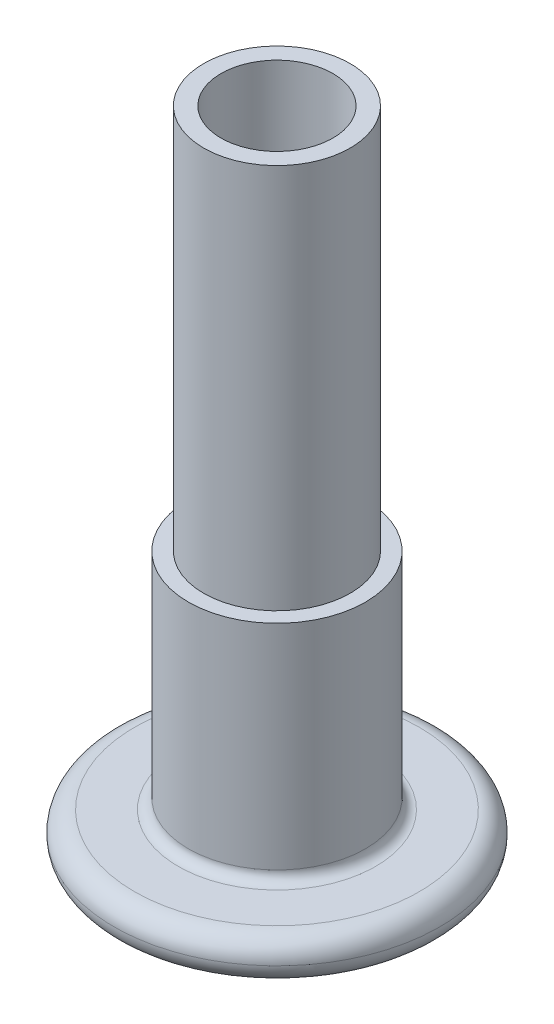
from build123d import *

# Parameters (mm, degrees)
SKETCH1_R           = 8.7
SKETCH1_R_2         = 5.5
BOSS_EXTRUDE1_DEPTH = 68.8
BOSS_EXTRUDE2_START = 4
SKETCH2_R           = 16
SKETCH2_R_2         = 5.5
BOSS_EXTRUDE2_DEPTH = 4
FILLET1_R           = 2
FILLET2_R           = 1
BOSS_EXTRUDE6_START = -10
BOSS_EXTRUDE6_DEPTH = 10
CUT_EXTRUDE1_START  = -23
SKETCH10_R          = 8.7
SKETCH10_R_2        = 7.2
CUT_EXTRUDE1_DEPTH  = 23
SKETCH11_R          = 17.428070689
CUT_EXTRUDE2_DEPTH  = 54.972215104
SKETCH12_R          = 7.2
SKETCH12_R_2        = 5.5
BOSS_EXTRUDE7_DEPTH = 14.9


with BuildPart() as part:
    # Sketch1 → Boss-Extrude1 (new body)
    with BuildSketch(Plane(origin=(0, 0, 0), x_dir=(1, 0, 0), z_dir=(0, 1, 0))):
        with Locations(Location((0, 0, 0), (0, 0, 90))):
            Circle(SKETCH1_R)
        with Locations(Location((0, 0, 0), (0, 0, 90))):
            Circle(SKETCH1_R_2, mode=Mode.SUBTRACT)
    extrude(amount=BOSS_EXTRUDE1_DEPTH)

    # Sketch2 → Boss-Extrude2 (add)
    with BuildSketch(Plane.XZ.offset(BOSS_EXTRUDE2_START)):
        with Locations(Location((0, 0, 0), (0, 0, 270))):
            Circle(SKETCH2_R)
        with Locations(Location((0, 0, 0), (0, 0, 270))):
            Circle(SKETCH2_R_2, mode=Mode.SUBTRACT)
    extrude(amount=-BOSS_EXTRUDE2_DEPTH)

    # Fillet1
    fillet1_edges = [part.edges().sort_by_distance(p)[0] for p in [
        (0, 0, 16),
        (0, -4, 16),
    ]]
    fillet(fillet1_edges, radius=FILLET1_R - 0.0001)  # a hair under: the kernel refuses the full size

    # Fillet2
    fillet2_edges = [part.edges().sort_by_distance(p)[0] for p in [
        (0, 0, 8.7),
    ]]
    fillet(fillet2_edges, radius=FILLET2_R)

    # Sketch7 → Boss-Extrude6 (add)
    with BuildSketch(Plane(origin=(0, 68.8, 0), x_dir=(1, 0, 0), z_dir=(0, 1, 0)).offset(BOSS_EXTRUDE6_START)):
        with BuildLine():
            Line((-8.459778344, -2.030307951), (-9.805994948, -2.807572454))
            ThreePointArc((-9.805994948, -2.807572454), (-8.832386986, -5.101856537), (-7.331446138, -7.091537035))
            Line((-7.331446138, -7.091537035), (-5.988187435, -6.311228981))
            ThreePointArc((-5.988187435, -6.311228981), (-7.534421013, -4.35), (-8.459778344, -2.030307951))
        make_face()
        with BuildLine():
            Line((-2.471590909, 8.341536931), (-2.475728155, 9.89498712))
            ThreePointArc((-2.475728155, 9.89498712), (0, 10.2), (2.475728155, 9.89498712))
            Line((2.475728155, 9.89498712), (2.471590909, 8.341536931))
            ThreePointArc((2.471590909, 8.341536931), (0, 8.7), (-2.471590909, 8.341536931))
        make_face()
        with BuildLine():
            Line((8.459778344, -2.030307951), (9.807174294, -2.803450085))
            ThreePointArc((9.807174294, -2.803450085), (8.833459119, -5.1), (7.331446138, -7.091537035))
            Line((7.331446138, -7.091537035), (5.988187435, -6.311228981))
            ThreePointArc((5.988187435, -6.311228981), (7.534421013, -4.35), (8.459778344, -2.030307951))
        make_face()
    extrude(amount=BOSS_EXTRUDE6_DEPTH)

    # Sketch10 → Cut-Extrude1 (cut)
    with BuildSketch(Plane(origin=(0, 45, 0), x_dir=(1, 0, 0), z_dir=(0, 1, 0)).offset(CUT_EXTRUDE1_START)):
        with Locations(Location((0, 0, 0), (0, 0, 90))):
            Circle(SKETCH10_R)
        with Locations(Location((0, 0, 0), (0, 0, 270))):
            Circle(SKETCH10_R_2, mode=Mode.SUBTRACT)
    extrude(amount=CUT_EXTRUDE1_DEPTH, mode=Mode.SUBTRACT)

    # Sketch11 → Cut-Extrude2 (cut, through all)
    with BuildSketch(Plane.XZ.offset(-45)):
        Circle(SKETCH11_R)
    extrude(amount=-CUT_EXTRUDE2_DEPTH, mode=Mode.SUBTRACT)

    # Sketch12 → Boss-Extrude7 (add)
    with BuildSketch(Plane(origin=(0, 45, 0), x_dir=(1, 0, 0), z_dir=(0, 1, 0))):
        with Locations(Location((0, 0, 0), (0, 0, 270))):
            Circle(SKETCH12_R)
        with Locations(Location((0, 0, 0), (0, 0, 90))):
            Circle(SKETCH12_R_2, mode=Mode.SUBTRACT)
    extrude(amount=BOSS_EXTRUDE7_DEPTH)


solid = part.part
